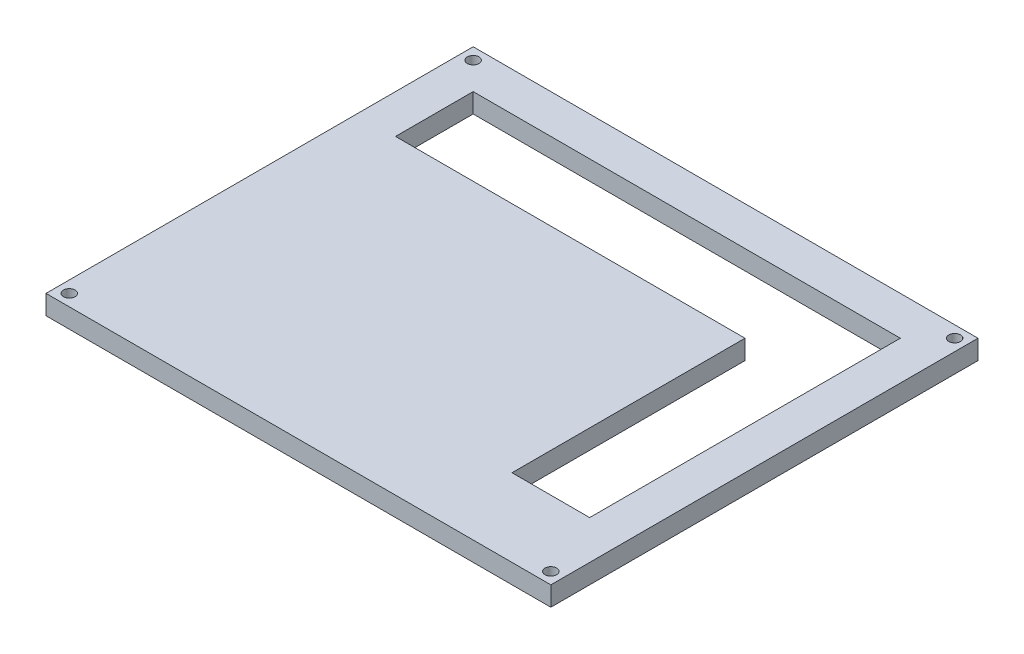
from build123d import *

# Parameters (mm, degrees)
SKETCH1_W               = 130
SKETCH1_H               = 110
BOSS_EXTRUDE1_DEPTH     = 5
SKETCH2_R               = 1.5
CUT_EXTRUDE1_DEPTH      = 86.293610546
MIRROR2_COPY_1_SKETCH_R = 1.5
MIRROR2_COPY_1_DEPTH    = 86.293610546
MIRROR2_COPY_2_SKETCH_R = 1.5
MIRROR2_COPY_2_DEPTH    = 86.293610546
CUT_EXTRUDE2_DEPTH      = 86.293610546


with BuildPart() as part:
    # Sketch1 → Boss-Extrude1 (new body)
    with BuildSketch(Plane(origin=(0, 0, 0), x_dir=(1, 0, 0), z_dir=(0, 1, 0))):
        Rectangle(SKETCH1_W, SKETCH1_H)
    extrude(amount=BOSS_EXTRUDE1_DEPTH)

    # Sketch2 → Cut-Extrude1 (cut, through all)
    with BuildSketch(Plane(origin=(0, 5, 0), x_dir=(1, 0, 0), z_dir=(0, 1, 0))):
        with Locations((-62, 52)):
            Circle(SKETCH2_R)
    cut_extrude1 = extrude(amount=-CUT_EXTRUDE1_DEPTH, mode=Mode.SUBTRACT)

    # Mirror1: Cut-Extrude1 across plane
    add(cut_extrude1.mirror(Plane.XY), mode=Mode.SUBTRACT)

    # Mirror2 copy 1 sketch → Mirror2 copy 1 (cut, through all)
    with BuildSketch(Plane(origin=(0, 5, 0), x_dir=(-1, 0, 0), z_dir=(0, 1, 0))):
        with Locations((-62, 52)):
            Circle(MIRROR2_COPY_1_SKETCH_R)
    extrude(amount=-MIRROR2_COPY_1_DEPTH, mode=Mode.SUBTRACT)

    # Mirror2 copy 2 sketch → Mirror2 copy 2 (cut, through all)
    with BuildSketch(Plane(origin=(0, 5, 0), x_dir=(-1, 0, 0), z_dir=(0, 1, 0))):
        with Locations((-62, -52)):
            Circle(MIRROR2_COPY_2_SKETCH_R)
    extrude(amount=-MIRROR2_COPY_2_DEPTH, mode=Mode.SUBTRACT)

    # Sketch3 → Cut-Extrude2 (cut, through all)
    with BuildSketch(Plane(origin=(0, 5, 0), x_dir=(1, 0, 0), z_dir=(0, 1, 0))):
        Polygon((-55, 25), (35, 25), (35, -35), (55, -35), (55, 25), (55, 45), (-55, 45), align=None)
    extrude(amount=-CUT_EXTRUDE2_DEPTH, mode=Mode.SUBTRACT)


solid = part.part
